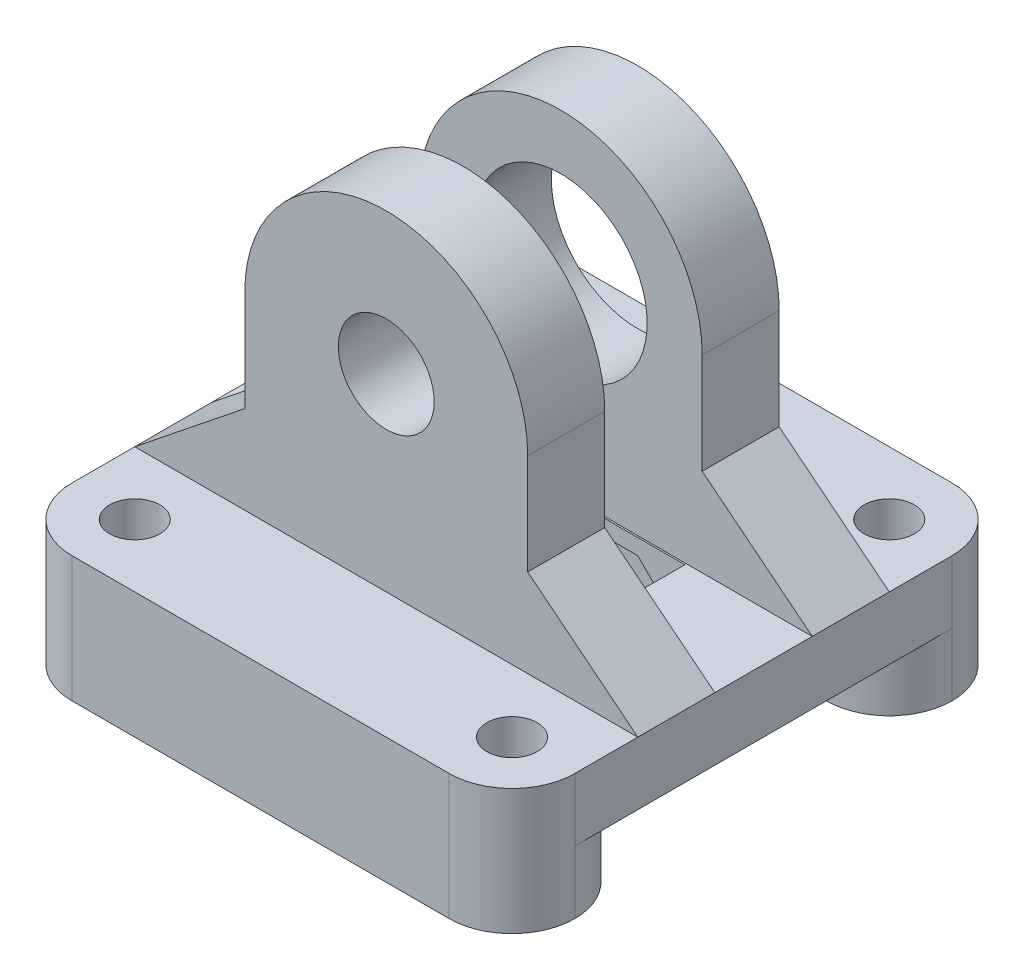
from build123d import *
from OCP.BRepFilletAPI import BRepFilletAPI_MakeChamfer

# Parameters (mm, degrees)
SKETCH1_R                = 1.6
SKETCH1_W                = 16
SKETCH1_H                = 16
BOSS_EXTRUDE1_DEPTH      = 8
SKETCH2_W                = 16
SKETCH2_H                = 4
CUT_EXTRUDE1_DEPTH       = 40
FILLET1_R                = 4
BOSS_EXTRUDE5_DEPTH      = 8
BOSS_EXTRUDE5_DEPTH_BACK = 1
SKETCH3_W                = 32
SKETCH3_H                = 5
CHAMFER1_SIZE            = 3
CHAMFER2_SIZE            = 8
CHAMFER2_SIZE2           = 10
SKETCH5_W                = 12
SKETCH5_H                = 5
BOSS_EXTRUDE7_DEPTH      = 8
FILLET2_R                = 4
SKETCH6_R                = 1.6
CUT_EXTRUDE2_DEPTH       = 20
SKETCH7_R                = 3.05
CUT_EXTRUDE3_DEPTH       = 9
SKETCH8_R                = 3.05
BOSS_EXTRUDE8_DEPTH      = 5
BOSS_EXTRUDE9_START      = -5
SKETCH9_R                = 1.6
BOSS_EXTRUDE9_DEPTH      = 5
SKETCH10_R               = 5.5
CUT_EXTRUDE4_DEPTH       = 9
CUT_EXTRUDE5_DEPTH       = 37


with BuildPart() as part:
    # Sketch1 → Boss-Extrude1 (new body)
    with BuildSketch(Plane(origin=(0, 0, 0), x_dir=(1, 0, 0), z_dir=(0, 1, 0))):
        with BuildLine():
            Line((-12, 16), (12, 16))
            ThreePointArc((12, 16), (14.828427125, 14.828427125), (16, 12))
            Line((16, 12), (16, -12))
            ThreePointArc((16, -12), (14.828427125, -14.828427125), (12, -16))
            Line((12, -16), (-12, -16))
            ThreePointArc((-12, -16), (-14.828427125, -14.828427125), (-16, -12))
            Line((-16, -12), (-16, 12))
            ThreePointArc((-16, 12), (-14.828427125, 14.828427125), (-12, 16))
        make_face()
        with Locations(Location((12, 12, 0), (0, 0, 270))):
            Circle(SKETCH1_R, mode=Mode.SUBTRACT)
        with Locations(Location((-12, 12, 0), (0, 0, 90))):
            Circle(SKETCH1_R, mode=Mode.SUBTRACT)
        with Locations(Location((12, -12, 0), (0, 0, 90))):
            Circle(SKETCH1_R, mode=Mode.SUBTRACT)
        with Locations(Location((-12, -12, 0), (0, 0, 270))):
            Circle(SKETCH1_R, mode=Mode.SUBTRACT)
        Rectangle(SKETCH1_W, SKETCH1_H, mode=Mode.SUBTRACT)
    extrude(amount=BOSS_EXTRUDE1_DEPTH)

    # Sketch2 → Cut-Extrude1 (cut)
    with BuildSketch(Plane(origin=(16, 0, 0), x_dir=(0, 0, -1), z_dir=(1, 0, 0))):
        with Locations((0, 2)):
            Rectangle(SKETCH2_W, SKETCH2_H)
    extrude(amount=-CUT_EXTRUDE1_DEPTH, mode=Mode.SUBTRACT)

    # Fillet1
    fillet1_edges = [part.edges().sort_by_distance(p)[0] for p in [
        (-16, 2, -8),
        (16, 2, -8),
        (-16, 2, 8),
        (16, 2, 8),
    ]]
    fillet(fillet1_edges, radius=FILLET1_R - 0.0001)  # a hair under: the kernel refuses the full size

    # Sketch3 → Boss-Extrude5 (add, two sides: drawn at the far end of the back side and taken through both)
    with BuildSketch(Plane(origin=(0, 8, 0), x_dir=(1, 0, 0), z_dir=(0, 1, 0)).offset(-BOSS_EXTRUDE5_DEPTH_BACK)):
        with Locations((0, 5.5)):
            Rectangle(SKETCH3_W, SKETCH3_H)
        with Locations((0, -5.5)):
            Rectangle(SKETCH3_W, SKETCH3_H)
    extrude(amount=BOSS_EXTRUDE5_DEPTH + BOSS_EXTRUDE5_DEPTH_BACK)

    # Chamfer1
    chamfer1_edges = [part.edges().sort_by_distance(p)[0] for p in [
        (8, 7, 5.5),
        (8, 7, -5.5),
        (-8, 7, -5.5),
        (-8, 7, 5.5),
    ]]
    chamfer(chamfer1_edges, length=CHAMFER1_SIZE - 0.0001)  # a hair under: the kernel refuses the full size

    # Chamfer2: one chamfer whose edges measure the first distance from different faces: ONE call of the kernel's chamfer builder (chamfer() names one face for all edges)
    chamfer2_edges_1 = [part.edges().sort_by_distance(p)[0] for p in [
        (16, 16, -5.5),
        (16, 16, 5.5),
    ]]
    chamfer2_side_1 = [part.faces().sort_by_distance(p)[0] for p in [
        (16, 0.288444102, -11.99995),
    ]]
    chamfer2_edges_2 = [part.edges().sort_by_distance(p)[0] for p in [
        (-16, 16, -5.5),
        (-16, 16, 5.5),
    ]]
    chamfer2_side_2 = [part.faces().sort_by_distance(p)[0] for p in [
        (-16, 0.288444102, 11.99995),
    ]]
    chamfer2 = BRepFilletAPI_MakeChamfer(part.part.solid().wrapped)
    for e in chamfer2_edges_1:
        chamfer2.Add(CHAMFER2_SIZE, CHAMFER2_SIZE2, e.wrapped, chamfer2_side_1[0].wrapped)  # the first distance lies on this face
    for e in chamfer2_edges_2:
        chamfer2.Add(CHAMFER2_SIZE, CHAMFER2_SIZE2, e.wrapped, chamfer2_side_2[0].wrapped)  # the first distance lies on this face
    add(Compound.cast(chamfer2.Shape()), mode=Mode.REPLACE)

    # Sketch5 → Boss-Extrude7 (add)
    with BuildSketch(Plane(origin=(0, 16, 0), x_dir=(1, 0, 0), z_dir=(0, 1, 0))):
        with Locations((0, 5.5)):
            Rectangle(SKETCH5_W, SKETCH5_H)
        with Locations((0, -5.5)):
            Rectangle(SKETCH5_W, SKETCH5_H)
    extrude(amount=BOSS_EXTRUDE7_DEPTH)

    # Fillet2
    fillet2_edges = [part.edges().sort_by_distance(p)[0] for p in [
        (-6, 24, -5.5),
        (6, 24, -5.5),
        (-6, 24, 5.5),
        (6, 24, 5.5),
    ]]
    fillet(fillet2_edges, radius=FILLET2_R)

    # Sketch6 → Cut-Extrude2 (cut)
    with BuildSketch(Plane.XY.offset(8)):
        with Locations((0, 20)):
            Circle(SKETCH6_R)
    extrude(amount=-CUT_EXTRUDE2_DEPTH, mode=Mode.SUBTRACT)

    # Sketch7 → Cut-Extrude3 (cut)
    with BuildSketch(Plane.XY.offset(8)):
        with Locations((0, 20)):
            Circle(SKETCH7_R)
    extrude(amount=-CUT_EXTRUDE3_DEPTH, mode=Mode.SUBTRACT)

    # Sketch8 → Boss-Extrude8 (add)
    with BuildSketch(Plane.XY.offset(8)):
        with BuildLine():
            Line((-9, 20), (-9, 11))
            Line((-9, 11), (0, 11))
            Line((0, 11), (9, 11))
            Line((9, 11), (9, 20))
            ThreePointArc((9, 20), (0, 29), (-9, 20))
        make_face()
        with Locations((0, 20)):
            Circle(SKETCH8_R, mode=Mode.SUBTRACT)
    extrude(amount=-BOSS_EXTRUDE8_DEPTH)

    # Sketch9 → Boss-Extrude9 (add)
    with BuildSketch(Plane(origin=(0, 0, -8), x_dir=(-1, 0, 0), z_dir=(0, 0, -1)).offset(BOSS_EXTRUDE9_START)):
        with BuildLine():
            Line((-9, 20), (-9, 11))
            Line((-9, 11), (9, 11))
            Line((9, 11), (9, 20))
            ThreePointArc((9, 20), (0, 29), (-9, 20))
        make_face()
        with Locations(Location((0, 20, 0), (0, 0, 180))):
            Circle(SKETCH9_R, mode=Mode.SUBTRACT)
    extrude(amount=BOSS_EXTRUDE9_DEPTH)

    # Sketch10 → Cut-Extrude4 (cut)
    with BuildSketch(Plane(origin=(0, 0, -8), x_dir=(-1, 0, 0), z_dir=(0, 0, -1))):
        with Locations((0, 20)):
            Circle(SKETCH10_R)
    extrude(amount=-CUT_EXTRUDE4_DEPTH, mode=Mode.SUBTRACT)

    # Sketch11 → Cut-Extrude5 (cut)
    with BuildSketch(Plane(origin=(0, 8, 0), x_dir=(1, 0, 0), z_dir=(0, 1, 0))):
        Polygon((0, 3.1), (23.961552098, 3.1), (23.961552098, -3.1), (0, -3.1), (-29.391122595, -3.1), (-29.391122595, 3.1), align=None)
    extrude(amount=CUT_EXTRUDE5_DEPTH, mode=Mode.SUBTRACT)


solid = part.part
